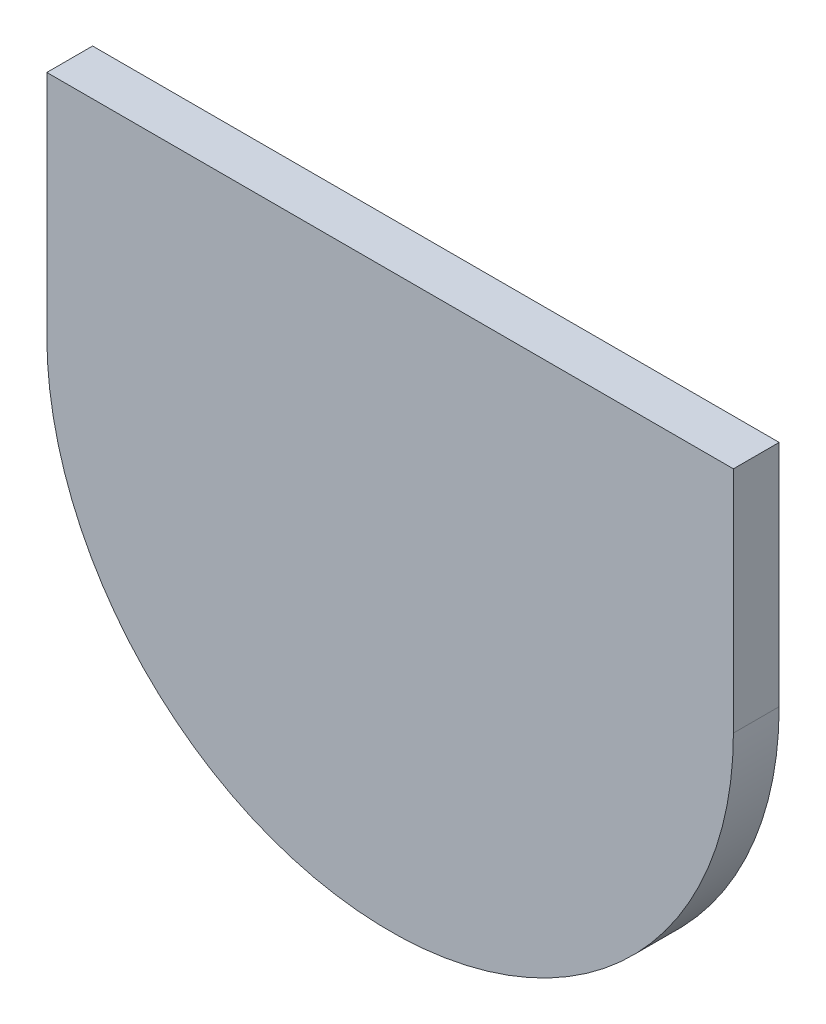
from build123d import *

# Parameters (mm, degrees)
BASE_FLANGE1_DEPTH = 1


# Sheet-metal steps are written as plain solids
with BuildPart() as part:
    # Sketch2 → Base-Flange1 (new body)
    with BuildSketch(Plane.XY):
        with BuildLine():
            Line((-12.5, 0), (-27.5, 0))
            Line((-27.5, 0), (-27.5, -5))
            ThreePointArc((-27.5, -5), (-20, -12.5), (-12.5, -5))
            Line((-12.5, -5), (-12.5, 0))
        make_face()
    extrude(amount=-BASE_FLANGE1_DEPTH)


solid = part.part
